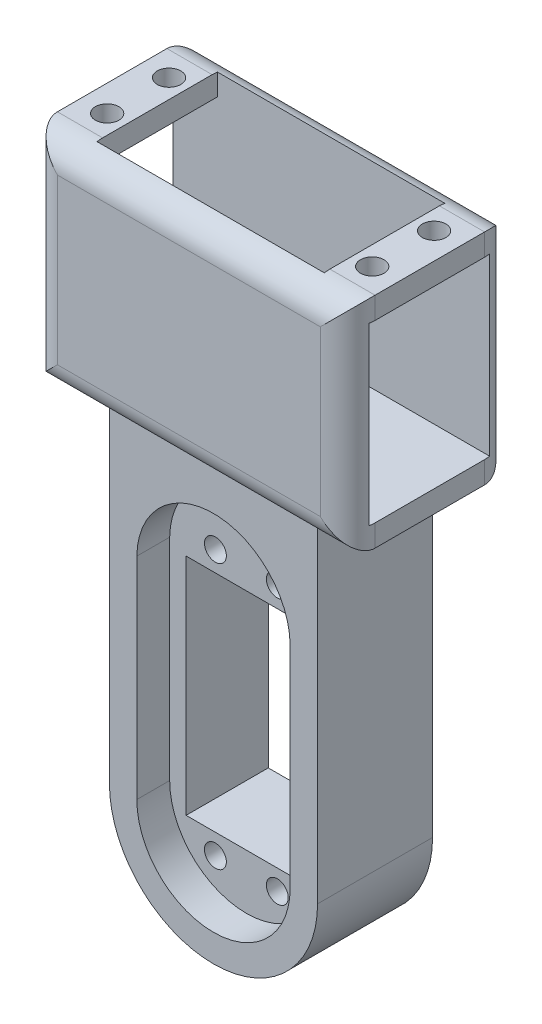
from build123d import *

# Parameters (mm, degrees)
SKETCH1_W                = 38
SKETCH1_H                = 120
BOSS_EXTRUDE1_DEPTH      = 13
FILLET1_R                = 19
SKETCH2_W                = 28
SKETCH2_H                = 43
BOSS_EXTRUDE2_DEPTH      = 8
SKETCH4_W                = 58
SKETCH4_H                = 30
BOSS_EXTRUDE3_DEPTH      = 40
SKETCH4_2_W              = 41.5
SKETCH4_2_H              = 22
SKETCH4_2_W_2            = 38
SKETCH4_2_H_2            = 21
CUT_EXTRUDE2_DEPTH       = 35
CUT_EXTRUDE3_REACH       = 137.699
SKETCH5_W                = 22
SKETCH5_H                = 32
CUT_EXTRUDE4_REACH       = 133.736
SKETCH7_R                = 2.15
FILLET2_R                = 5
CUT_EXTRUDE5_START       = -8
CUT_EXTRUDE5_DEPTH       = 8
BOSS_EXTRUDE4_DEPTH      = 8
SKETCH9_W                = 22
SKETCH9_H                = 41
CUT_EXTRUDE20_DEPTH      = 131.859657649
CUT_EXTRUDE22_DEPTH      = 131.859657649
CUT_EXTRUDE22_DEPTH_BACK = 131.859657649
SKETCH11_R               = 2
SKETCH11_W               = 22
SKETCH11_H               = 41
SKETCH12_R               = 2
SKETCH12_W               = 22
SKETCH12_H               = 41
BOSS_EXTRUDE6_DEPTH      = 10


# Some blends are built 0.0001 mm under size
with BuildPart() as part:
    # Sketch1 → Boss-Extrude1 (new body)
    with BuildSketch(Plane.XY):
        with Locations((19, 60)):
            Rectangle(SKETCH1_W, SKETCH1_H)
    extrude(amount=BOSS_EXTRUDE1_DEPTH)

    # Fillet1
    fillet1_edges = [part.edges().sort_by_distance(p)[0] for p in [
        (38, 0, 6.5),
        (0, 0, 6.5),
    ]]
    fillet(fillet1_edges, radius=FILLET1_R - 0.0001)  # a hair under: the kernel refuses the full size

    # Sketch2 → Boss-Extrude2 (add)
    with BuildSketch(Plane.XY.offset(13)):
        with BuildLine():
            Line((33, 72), (33, 19))
            ThreePointArc((33, 19), (28.899494937, 9.100505063), (19, 5))
            ThreePointArc((19, 5), (9.100505063, 9.100505063), (5, 19))
            Line((5, 19), (5, 72))
            Line((5, 72), (0, 72))
            Line((0, 72), (0, 19))
            ThreePointArc((0, 19), (5.564971157, 5.564971157), (19, 0))
            ThreePointArc((19, 0), (32.435028843, 5.564971157), (38, 19))
            Line((38, 19), (38, 72))
            Line((38, 72), (33, 72))
        make_face()
        Polygon((33, 115), (33, 72), (38, 72), (38, 120), (0, 120), (0, 72), (5, 72), (5, 115), align=None)
        with Locations((19, 93.5)):
            Rectangle(SKETCH2_W, SKETCH2_H)
    extrude(amount=BOSS_EXTRUDE2_DEPTH)

    # Sketch4 → Boss-Extrude3 (add)
    with BuildSketch(Plane(origin=(0, 120, 0), x_dir=(1, 0, 0), z_dir=(0, 1, 0))):
        with Locations((19, -10.5)):
            Rectangle(SKETCH4_W, SKETCH4_H)
    extrude(amount=-BOSS_EXTRUDE3_DEPTH)

    # Sketch4<2> → Cut-Extrude2 (cut)
    # profile 1 of 2: a face of its own
    with BuildSketch(Plane(origin=(0, 120, 0), x_dir=(1, 0, 0), z_dir=(0, 1, 0))):
        with Locations((19, -10.5)):
            Rectangle(SKETCH4_2_W, SKETCH4_2_H)
        with Locations((19, -10.5)):
            Rectangle(SKETCH4_2_W_2, SKETCH4_2_H_2, mode=Mode.SUBTRACT)
    # profile 2 of 2: a face of its own
    with BuildSketch(Plane(origin=(0, 120, 0), x_dir=(1, 0, 0), z_dir=(0, 1, 0))):
        with Locations((19, -10.5)):
            Rectangle(SKETCH4_2_W_2, SKETCH4_2_H_2)
    extrude(amount=-CUT_EXTRUDE2_DEPTH, mode=Mode.SUBTRACT)

    # Sketch5 → Cut-Extrude3 (cut, up to next)
    with BuildSketch(Plane.ZY.offset(10), mode=Mode.PRIVATE) as cut_extrude3_sk1:
        with Locations((10.5, 100)):
            Rectangle(SKETCH5_W, SKETCH5_H)
    cut_extrude3_tool1 = extrude(cut_extrude3_sk1.sketch, amount=-CUT_EXTRUDE3_REACH, mode=Mode.PRIVATE) & part.part
    add(cut_extrude3_tool1.solids().sort_by_distance((-10, 100, 10.5))[0], mode=Mode.SUBTRACT)

    # Sketch7 → Cut-Extrude4 (cut, up to next)
    with BuildSketch(Plane(origin=(0, 120, 0), x_dir=(1, 0, 0), z_dir=(0, 1, 0)), mode=Mode.PRIVATE) as cut_extrude4_sk1:
        with Locations(Location((-5.2, -4.92, 0), (0, 0, 270))):
            Circle(SKETCH7_R)
    cut_extrude4_tool1 = extrude(cut_extrude4_sk1.sketch, amount=-CUT_EXTRUDE4_REACH, mode=Mode.PRIVATE) & part.part
    # Sketch7 → Cut-Extrude4 (cut, up to next)
    with BuildSketch(Plane(origin=(0, 120, 0), x_dir=(1, 0, 0), z_dir=(0, 1, 0)), mode=Mode.PRIVATE) as cut_extrude4_sk2:
        with Locations(Location((-5.2, -16.22, 0), (0, 0, 270))):
            Circle(SKETCH7_R)
    cut_extrude4_tool2 = extrude(cut_extrude4_sk2.sketch, amount=-CUT_EXTRUDE4_REACH, mode=Mode.PRIVATE) & part.part
    # Sketch7 → Cut-Extrude4 (cut, up to next)
    with BuildSketch(Plane(origin=(0, 120, 0), x_dir=(1, 0, 0), z_dir=(0, 1, 0)), mode=Mode.PRIVATE) as cut_extrude4_sk3:
        with Locations(Location((43.2, -4.92, 0), (0, 0, 270))):
            Circle(SKETCH7_R)
    cut_extrude4_tool3 = extrude(cut_extrude4_sk3.sketch, amount=-CUT_EXTRUDE4_REACH, mode=Mode.PRIVATE) & part.part
    # Sketch7 → Cut-Extrude4 (cut, up to next)
    with BuildSketch(Plane(origin=(0, 120, 0), x_dir=(1, 0, 0), z_dir=(0, 1, 0)), mode=Mode.PRIVATE) as cut_extrude4_sk4:
        with Locations(Location((43.2, -16.22, 0), (0, 0, 270))):
            Circle(SKETCH7_R)
    cut_extrude4_tool4 = extrude(cut_extrude4_sk4.sketch, amount=-CUT_EXTRUDE4_REACH, mode=Mode.PRIVATE) & part.part
    # Sketch7 → Cut-Extrude4 (cut, up to next)
    with BuildSketch(Plane(origin=(0, 120, 0), x_dir=(1, 0, 0), z_dir=(0, 1, 0)), mode=Mode.PRIVATE) as cut_extrude4_sk5:
        with Locations(Location((-5.2, -4.92, 0), (0, 0, 270))):
            Circle(SKETCH7_R)
    cut_extrude4_tool5 = extrude(cut_extrude4_sk5.sketch, amount=-CUT_EXTRUDE4_REACH, mode=Mode.PRIVATE) & part.part
    add(cut_extrude4_tool1.solids().sort_by_distance((-5.2, 120, 4.92))[0], mode=Mode.SUBTRACT)
    add(cut_extrude4_tool2.solids().sort_by_distance((-5.2, 120, 16.22))[0], mode=Mode.SUBTRACT)
    add(cut_extrude4_tool3.solids().sort_by_distance((43.2, 120, 4.92))[0], mode=Mode.SUBTRACT)
    add(cut_extrude4_tool4.solids().sort_by_distance((43.2, 120, 16.22))[0], mode=Mode.SUBTRACT)
    add(cut_extrude4_tool5.solids().sort_by_distance((-5.2, 120, 4.92))[0], mode=Mode.SUBTRACT)

    # Fillet2
    # the kernel refuses this fillet: 5 mm, written as the material it takes off along each edge
    with BuildSketch(Plane(origin=(-10, 132.5, -4.5), x_dir=(1, 0, 0), z_dir=(0, -1, 0)), Plane(origin=(-10, 132.5, 25.5), x_dir=(0, 0, -1), z_dir=(0, -1, 0))) as fillet2_piece_1:
        with BuildLine():
            CenterArc((FILLET2_R, FILLET2_R), FILLET2_R, 180, 90)
            Line((0, FILLET2_R), (0, 0))
            Line((0, 0), (FILLET2_R, 0))
        make_face()
    extrude(amount=65, mode=Mode.SUBTRACT)
    with BuildSketch(Plane(origin=(-22.5, 120, -4.5), x_dir=(0, -1, 0), z_dir=(1, 0, 0)), Plane(origin=(60.5, 120, 25.5), x_dir=(0, -1, 0), z_dir=(-1, 0, 0))) as fillet2_piece_2:
        with BuildLine():
            CenterArc((FILLET2_R, -FILLET2_R), FILLET2_R, 90, 90)
            Line((0, -FILLET2_R), (0, 0))
            Line((0, 0), (FILLET2_R, 0))
        make_face()
    extrude(amount=83, mode=Mode.SUBTRACT)
    with BuildSketch(Plane(origin=(-22.5, 80, -4.5), x_dir=(0, 0, 1), z_dir=(1, 0, 0))) as fillet2_piece_3_section:
        with BuildLine():
            CenterArc((FILLET2_R, -FILLET2_R), FILLET2_R, 90, 90)
            Line((0, -FILLET2_R), (0, 0))
            Line((0, 0), (FILLET2_R, 0))
        make_face()
    fillet2_piece_3 = extrude(amount=83, mode=Mode.PRIVATE)
    fillet2_piece_3 = split(fillet2_piece_3, bisect_by=Plane(origin=(-11.25, 79.954430424, 0), z_dir=(0, 0, 1)), keep=Keep.TOP, mode=Mode.PRIVATE)
    fillet2_piece_3 = split(fillet2_piece_3, bisect_by=Plane(origin=(0, 79.954430424, 0.240366423), z_dir=(-1, 0, 0)), keep=Keep.TOP, mode=Mode.PRIVATE)
    add(fillet2_piece_3, mode=Mode.SUBTRACT)
    with BuildSketch(Plane(origin=(-22.5, 80, -4.5), x_dir=(0, 0, 1), z_dir=(1, 0, 0))) as fillet2_piece_4_section:
        with BuildLine():
            CenterArc((FILLET2_R, -FILLET2_R), FILLET2_R, 90, 90)
            Line((0, -FILLET2_R), (0, 0))
            Line((0, 0), (FILLET2_R, 0))
        make_face()
    fillet2_piece_4 = extrude(amount=83, mode=Mode.PRIVATE)
    fillet2_piece_4 = split(fillet2_piece_4, bisect_by=Plane(origin=(-11.25, 81.142067703, 0), z_dir=(0, 0, -1)), keep=Keep.TOP, mode=Mode.PRIVATE)
    fillet2_piece_4 = split(fillet2_piece_4, bisect_by=Plane(origin=(0, 81.142067703, -3.398950084), z_dir=(-1, 0, 0)), keep=Keep.TOP, mode=Mode.PRIVATE)
    add(fillet2_piece_4, mode=Mode.SUBTRACT)
    with BuildSketch(Plane(origin=(-22.5, 80, -4.5), x_dir=(0, 0, 1), z_dir=(1, 0, 0))) as fillet2_piece_5_section:
        with BuildLine():
            CenterArc((FILLET2_R, -FILLET2_R), FILLET2_R, 90, 90)
            Line((0, -FILLET2_R), (0, 0))
            Line((0, 0), (FILLET2_R, 0))
        make_face()
    fillet2_piece_5 = extrude(amount=83, mode=Mode.PRIVATE)
    fillet2_piece_5 = split(fillet2_piece_5, bisect_by=Plane(origin=(19, 81.142067703, 0), z_dir=(0, 0, -1)), keep=Keep.TOP, mode=Mode.PRIVATE)
    fillet2_piece_5 = split(fillet2_piece_5, bisect_by=Plane(origin=(0, 81.142067703, -3.398950084), z_dir=(1, 0, 0)), keep=Keep.TOP, mode=Mode.PRIVATE)
    fillet2_piece_5 = split(fillet2_piece_5, bisect_by=Plane(origin=(38, 81.142067703, -3.398950084), z_dir=(-1, 0, 0)), keep=Keep.TOP, mode=Mode.PRIVATE)
    add(fillet2_piece_5, mode=Mode.SUBTRACT)
    with BuildSketch(Plane(origin=(-22.5, 80, -4.5), x_dir=(0, 0, 1), z_dir=(1, 0, 0))) as fillet2_piece_6_section:
        with BuildLine():
            CenterArc((FILLET2_R, -FILLET2_R), FILLET2_R, 90, 90)
            Line((0, -FILLET2_R), (0, 0))
            Line((0, 0), (FILLET2_R, 0))
        make_face()
    fillet2_piece_6 = extrude(amount=83, mode=Mode.PRIVATE)
    fillet2_piece_6 = split(fillet2_piece_6, bisect_by=Plane(origin=(49.25, 79.954430424, 0), z_dir=(0, 0, 1)), keep=Keep.TOP, mode=Mode.PRIVATE)
    fillet2_piece_6 = split(fillet2_piece_6, bisect_by=Plane(origin=(38, 79.954430424, 0.240366423), z_dir=(1, 0, 0)), keep=Keep.TOP, mode=Mode.PRIVATE)
    add(fillet2_piece_6, mode=Mode.SUBTRACT)
    with BuildSketch(Plane(origin=(-22.5, 80, -4.5), x_dir=(0, 0, 1), z_dir=(1, 0, 0))) as fillet2_piece_7_section:
        with BuildLine():
            CenterArc((FILLET2_R, -FILLET2_R), FILLET2_R, 90, 90)
            Line((0, -FILLET2_R), (0, 0))
            Line((0, 0), (FILLET2_R, 0))
        make_face()
    fillet2_piece_7 = extrude(amount=83, mode=Mode.PRIVATE)
    fillet2_piece_7 = split(fillet2_piece_7, bisect_by=Plane(origin=(49.25, 81.142067703, 0), z_dir=(0, 0, -1)), keep=Keep.TOP, mode=Mode.PRIVATE)
    fillet2_piece_7 = split(fillet2_piece_7, bisect_by=Plane(origin=(38, 81.142067703, -3.398950084), z_dir=(1, 0, 0)), keep=Keep.TOP, mode=Mode.PRIVATE)
    add(fillet2_piece_7, mode=Mode.SUBTRACT)
    with BuildSketch(Plane(origin=(48, 132.5, -4.5), x_dir=(-1, 0, 0), z_dir=(0, -1, 0)), Plane(origin=(48, 132.5, 25.5), x_dir=(0, 0, -1), z_dir=(0, -1, 0))) as fillet2_piece_8:
        with BuildLine():
            CenterArc((FILLET2_R, -FILLET2_R), FILLET2_R, 90, 90)
            Line((0, -FILLET2_R), (0, 0))
            Line((0, 0), (FILLET2_R, 0))
        make_face()
    extrude(amount=65, mode=Mode.SUBTRACT)
    with BuildSketch(Plane(origin=(60.5, 80, 25.5), x_dir=(0, 0, -1), z_dir=(-1, 0, 0))) as fillet2_piece_9_section:
        with BuildLine():
            CenterArc((FILLET2_R, -FILLET2_R), FILLET2_R, 90, 90)
            Line((0, -FILLET2_R), (0, 0))
            Line((0, 0), (FILLET2_R, 0))
        make_face()
    fillet2_piece_9 = extrude(amount=83, mode=Mode.PRIVATE)
    fillet2_piece_9 = split(fillet2_piece_9, bisect_by=Plane(origin=(38, 79.954430424, 20.759633577), z_dir=(1, 0, 0)), keep=Keep.TOP, mode=Mode.PRIVATE)
    fillet2_piece_9 = split(fillet2_piece_9, bisect_by=Plane(origin=(49.25, 79.954430424, 21), z_dir=(0, 0, -1)), keep=Keep.TOP, mode=Mode.PRIVATE)
    add(fillet2_piece_9, mode=Mode.SUBTRACT)
    with BuildSketch(Plane(origin=(60.5, 80, 25.5), x_dir=(0, 0, -1), z_dir=(-1, 0, 0))) as fillet2_piece_10_section:
        with BuildLine():
            CenterArc((FILLET2_R, -FILLET2_R), FILLET2_R, 90, 90)
            Line((0, -FILLET2_R), (0, 0))
            Line((0, 0), (FILLET2_R, 0))
        make_face()
    fillet2_piece_10 = extrude(amount=83, mode=Mode.PRIVATE)
    fillet2_piece_10 = split(fillet2_piece_10, bisect_by=Plane(origin=(38, 81.142067703, 24.398950084), z_dir=(1, 0, 0)), keep=Keep.TOP, mode=Mode.PRIVATE)
    fillet2_piece_10 = split(fillet2_piece_10, bisect_by=Plane(origin=(49.25, 81.142067703, 21), z_dir=(0, 0, 1)), keep=Keep.TOP, mode=Mode.PRIVATE)
    add(fillet2_piece_10, mode=Mode.SUBTRACT)
    with BuildSketch(Plane(origin=(60.5, 80, 25.5), x_dir=(0, 0, -1), z_dir=(-1, 0, 0))) as fillet2_piece_11_section:
        with BuildLine():
            CenterArc((FILLET2_R, -FILLET2_R), FILLET2_R, 90, 90)
            Line((0, -FILLET2_R), (0, 0))
            Line((0, 0), (FILLET2_R, 0))
        make_face()
    fillet2_piece_11 = extrude(amount=83, mode=Mode.PRIVATE)
    fillet2_piece_11 = split(fillet2_piece_11, bisect_by=Plane(origin=(0, 81.142067703, 24.398950084), z_dir=(1, 0, 0)), keep=Keep.TOP, mode=Mode.PRIVATE)
    fillet2_piece_11 = split(fillet2_piece_11, bisect_by=Plane(origin=(38, 81.142067703, 24.398950084), z_dir=(-1, 0, 0)), keep=Keep.TOP, mode=Mode.PRIVATE)
    fillet2_piece_11 = split(fillet2_piece_11, bisect_by=Plane(origin=(19, 81.142067703, 21), z_dir=(0, 0, 1)), keep=Keep.TOP, mode=Mode.PRIVATE)
    add(fillet2_piece_11, mode=Mode.SUBTRACT)
    with BuildSketch(Plane(origin=(60.5, 80, 25.5), x_dir=(0, 0, -1), z_dir=(-1, 0, 0))) as fillet2_piece_12_section:
        with BuildLine():
            CenterArc((FILLET2_R, -FILLET2_R), FILLET2_R, 90, 90)
            Line((0, -FILLET2_R), (0, 0))
            Line((0, 0), (FILLET2_R, 0))
        make_face()
    fillet2_piece_12 = extrude(amount=83, mode=Mode.PRIVATE)
    fillet2_piece_12 = split(fillet2_piece_12, bisect_by=Plane(origin=(0, 79.954430424, 20.759633577), z_dir=(-1, 0, 0)), keep=Keep.TOP, mode=Mode.PRIVATE)
    fillet2_piece_12 = split(fillet2_piece_12, bisect_by=Plane(origin=(-11.25, 79.954430424, 21), z_dir=(0, 0, -1)), keep=Keep.TOP, mode=Mode.PRIVATE)
    add(fillet2_piece_12, mode=Mode.SUBTRACT)
    with BuildSketch(Plane(origin=(60.5, 80, 25.5), x_dir=(0, 0, -1), z_dir=(-1, 0, 0))) as fillet2_piece_13_section:
        with BuildLine():
            CenterArc((FILLET2_R, -FILLET2_R), FILLET2_R, 90, 90)
            Line((0, -FILLET2_R), (0, 0))
            Line((0, 0), (FILLET2_R, 0))
        make_face()
    fillet2_piece_13 = extrude(amount=83, mode=Mode.PRIVATE)
    fillet2_piece_13 = split(fillet2_piece_13, bisect_by=Plane(origin=(0, 81.142067703, 24.398950084), z_dir=(-1, 0, 0)), keep=Keep.TOP, mode=Mode.PRIVATE)
    fillet2_piece_13 = split(fillet2_piece_13, bisect_by=Plane(origin=(-11.25, 81.142067703, 21), z_dir=(0, 0, 1)), keep=Keep.TOP, mode=Mode.PRIVATE)
    add(fillet2_piece_13, mode=Mode.SUBTRACT)

    # Sketch3<3> → Cut-Extrude5 (cut)
    with BuildSketch(Plane.XY.offset(13).offset(CUT_EXTRUDE5_START)):
        with BuildLine():
            Line((5, 57.485100075), (5, 57))
            Line((5, 57), (5, 19))
            ThreePointArc((5, 19), (19, 5), (33, 19))
            Line((33, 19), (33, 57))
            Line((33, 57), (33, 57.485100075))
            ThreePointArc((33, 57.485100075), (19, 71.24465097), (5, 57.485100075))
        make_face()
    extrude(amount=CUT_EXTRUDE5_DEPTH, mode=Mode.SUBTRACT)

    # Sketch3 → Boss-Extrude4 (add)
    with BuildSketch(Plane.XY.offset(13)):
        with BuildLine():
            Line((5, 72), (5, 57.485100075))
            ThreePointArc((5, 57.485100075), (19, 71.24465097), (33, 57.485100075))
            Line((33, 57.485100075), (33, 72))
            Line((33, 72), (5, 72))
        make_face()
    extrude(amount=BOSS_EXTRUDE4_DEPTH)

    # Sketch9 → Cut-Extrude20 (cut, through all)
    with BuildSketch(Plane.XY.offset(5)):
        with Locations((19, 35.5)):
            Rectangle(SKETCH9_W, SKETCH9_H)
        with BuildLine():
            Line((11.609906409, 27.348861392), (11.609906409, 26.503403734))
            ThreePointArc((11.609906409, 26.503403734), (13.879652291, 15.001207086), (16.608900022, 26.403113985))
            Line((16.608900022, 26.403113985), (16.608900022, 27.248571642))
            ThreePointArc((16.608900022, 27.248571642), (14.159570107, 29.799310765), (11.609906409, 27.348861392))
        make_face(mode=Mode.SUBTRACT)
    extrude(amount=-CUT_EXTRUDE20_DEPTH, mode=Mode.SUBTRACT)


with BuildPart() as cut_extrude20_kept_piece:
    # of the separate pieces the step leaves, the one the design keeps (cut_extrude20_pieces_kept)
    add(part.part.solids().sort_by_distance((18.9999, 0, 0))[0])

    # Sketch11 → Cut-Extrude22 (cut, two sides: drawn at the far end of the back side and taken through both)
    with BuildSketch(Plane.XY.offset(5).offset(-CUT_EXTRUDE22_DEPTH_BACK)):
        with Locations((13.35, 59.7)):
            Circle(SKETCH11_R)
        with Locations((24.65, 59.7)):
            Circle(SKETCH11_R)
        with Locations((24.65, 11.3)):
            Circle(SKETCH11_R)
        with Locations((13.35, 11.3)):
            Circle(SKETCH11_R)
        with Locations((19, 35.5)):
            Rectangle(SKETCH11_W, SKETCH11_H)
    extrude(amount=CUT_EXTRUDE22_DEPTH + CUT_EXTRUDE22_DEPTH_BACK, mode=Mode.SUBTRACT)

    # Sketch12 → Boss-Extrude6 (add)
    with BuildSketch(Plane.XY.offset(5)):
        with BuildLine():
            Line((33, 19), (33, 57.485100075))
            ThreePointArc((33, 57.485100075), (19, 71.24465097), (5, 57.485100075))
            Line((5, 57.485100075), (5, 19))
            ThreePointArc((5, 19), (19, 5), (33, 19))
        make_face()
        with Locations((24.65, 11.3)):
            Circle(SKETCH12_R, mode=Mode.SUBTRACT)
        with Locations((13.35, 11.3)):
            Circle(SKETCH12_R, mode=Mode.SUBTRACT)
        with Locations((13.35, 59.7)):
            Circle(SKETCH12_R, mode=Mode.SUBTRACT)
        with Locations((24.65, 59.7)):
            Circle(SKETCH12_R, mode=Mode.SUBTRACT)
        with Locations((19, 35.5)):
            Rectangle(SKETCH12_W, SKETCH12_H, mode=Mode.SUBTRACT)
    extrude(amount=BOSS_EXTRUDE6_DEPTH)


solid = cut_extrude20_kept_piece.part
